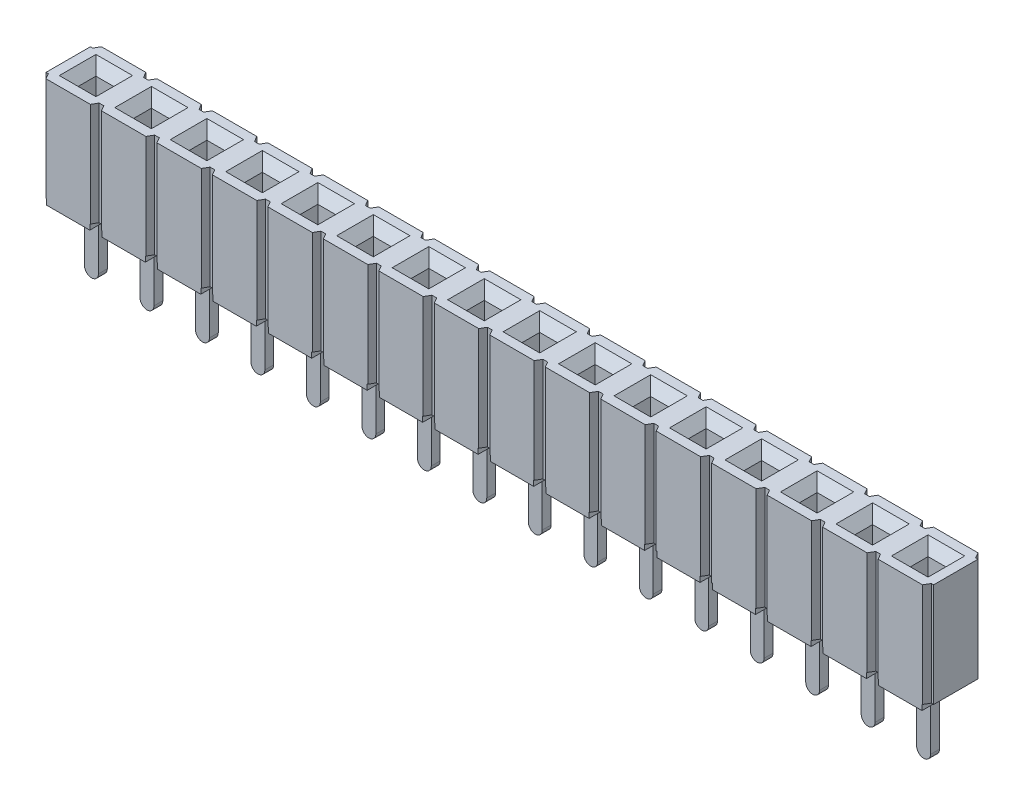
from build123d import *

# Parameters (mm, degrees)
SKETCH1_W                      = 40.64
SKETCH1_H                      = 2.54
BASE_EXTRUDE_DEPTH             = 5
SKETCH2_W                      = 1.524
SKETCH2_H                      = 0.254
STANDOFF_WIDTH_DEPTH           = 41.966114046
UPPER_START                    = -19.4945
UPPER_CORE_OUTLINE_W           = 3.3528
UPPER_CORE_OUTLINE_H           = 0.889
UPPER_CORE_DEPTH               = 0.889
LEAD_IN_SIZE                   = 0.3937
LEAD_IN_SIZE2                  = 0.469193389
CORE_PATTERN_COUNT             = 16
CORE_PATTERN_PITCH             = 2.54
LEAD_IN_OF_CORE_PATTERN_SIZE2  = 0.469193389
LEAD_IN_OF_CORE_PATTERN_SIZE   = 0.3937
POSITION_CUT_DEPTH             = 21.964620197
SKETCH10_W                     = 0.2794
SKETCH10_H                     = 0.254
STANDOFF_LENGTH_DEPTH          = 22.07970588
STANDOFF_PATTERN_COUNT         = 16
STANDOFF_PATTERN_PITCH         = 2.54
SKETCH11_W                     = 0.635
SKETCH11_H                     = 0.4064
TAIL_DEPTH                     = 3.175
TAIL_FILLETS_R                 = 0.3175
TAIL_PATTERN_COUNT             = 16
TAIL_PATTERN_PITCH             = 2.54
TAIL_FILLETS_OF_TAIL_PATTERN_R = 0.3175


# Read off the part's stored shape, not the designer's step: Upper Core
with BuildPart() as part:
    # Sketch1 → Base-Extrude (new body)
    with BuildSketch(Plane(origin=(0, 0, 0), x_dir=(1, 0, 0), z_dir=(0, 1, 0))):
        Rectangle(SKETCH1_W, SKETCH1_H)
    extrude(amount=BASE_EXTRUDE_DEPTH)

    # Sketch2 → Standoff - Width (cut, through all)
    with BuildSketch(Plane.ZY.offset(20.32)):
        with Locations((0, 0.127)):
            Rectangle(SKETCH2_W, SKETCH2_H)
    extrude(amount=-STANDOFF_WIDTH_DEPTH, mode=Mode.SUBTRACT)

    # Upper Core outline → Upper Core (cut)
    with BuildSketch(Plane.YZ.offset(UPPER_START)):
        with Locations((3.3236, 0)):
            Rectangle(UPPER_CORE_OUTLINE_W, UPPER_CORE_OUTLINE_H)
    upper_core = extrude(amount=UPPER_CORE_DEPTH, mode=Mode.SUBTRACT)

    # Lead-in
    lead_in_edges = [part.edges().sort_by_distance(p)[0] for p in [
        (-19.4945, 5, 0),
        (-19.05, 5, 0.4445),
        (-18.6055, 5, 0),
        (-19.05, 5, -0.4445),
    ]]
    lead_in_side = [part.faces().sort_by_distance(p)[0] for p in [
        (0.146976854, 5, 0),
    ]]
    chamfer(lead_in_edges, length=LEAD_IN_SIZE, length2=LEAD_IN_SIZE2, reference=lead_in_side[0])

    # Core Pattern: Upper Core ×16
    with Locations(*[(i * CORE_PATTERN_PITCH, 0, 0) for i in range(1, CORE_PATTERN_COUNT)]):
        add(upper_core, mode=Mode.SUBTRACT)

    # Lead-in of Core Pattern
    lead_in_of_core_pattern_edges = [part.edges().sort_by_distance(p)[0] for p in [
        (-16.9545, 5, 0),
        (-16.51, 5, 0.4445),
        (-16.0655, 5, 0),
        (-16.51, 5, -0.4445),
        (-14.4145, 5, 0),
        (-13.97, 5, 0.4445),
        (-13.5255, 5, 0),
        (-13.97, 5, -0.4445),
        (-11.8745, 5, 0),
        (-11.43, 5, 0.4445),
        (-10.9855, 5, 0),
        (-11.43, 5, -0.4445),
        (-9.3345, 5, 0),
        (-8.89, 5, 0.4445),
        (-8.4455, 5, 0),
        (-8.89, 5, -0.4445),
        (-6.7945, 5, 0),
        (-6.35, 5, 0.4445),
        (-5.9055, 5, 0),
        (-6.35, 5, -0.4445),
        (-4.2545, 5, 0),
        (-3.81, 5, 0.4445),
        (-3.3655, 5, 0),
        (-3.81, 5, -0.4445),
        (-1.7145, 5, 0),
        (-1.27, 5, 0.4445),
        (-0.8255, 5, 0),
        (-1.27, 5, -0.4445),
        (0.8255, 5, 0),
        (1.27, 5, 0.4445),
        (1.7145, 5, 0),
        (1.27, 5, -0.4445),
        (3.3655, 5, 0),
        (3.81, 5, 0.4445),
        (4.2545, 5, 0),
        (3.81, 5, -0.4445),
        (5.9055, 5, 0),
        (6.35, 5, 0.4445),
        (6.7945, 5, 0),
        (6.35, 5, -0.4445),
        (8.4455, 5, 0),
        (8.89, 5, 0.4445),
        (9.3345, 5, 0),
        (8.89, 5, -0.4445),
        (10.9855, 5, 0),
        (11.43, 5, 0.4445),
        (11.8745, 5, 0),
        (11.43, 5, -0.4445),
        (13.5255, 5, 0),
        (13.97, 5, 0.4445),
        (14.4145, 5, 0),
        (13.97, 5, -0.4445),
        (16.0655, 5, 0),
        (16.51, 5, 0.4445),
        (16.9545, 5, 0),
        (16.51, 5, -0.4445),
        (18.6055, 5, 0),
        (19.05, 5, 0.4445),
        (19.4945, 5, 0),
        (19.05, 5, -0.4445),
    ]]
    chamfer(lead_in_of_core_pattern_edges, length=LEAD_IN_OF_CORE_PATTERN_SIZE, length2=LEAD_IN_OF_CORE_PATTERN_SIZE2)

    # Sketch4 → Position Cut (cut, through all)
    with BuildSketch(Plane(origin=(0, 5, 0), x_dir=(-1, 0, 0), z_dir=(0, 1, 0))):
        Polygon((20.32, 1.016), (20.212646968, 1.016), (20.066, 1.27), (20.32, 1.27), align=None)
        Polygon((20.066, -1.27), (20.32, -1.27), (20.32, -1.016), (20.212646968, -1.016), align=None)
        Polygon((17.78, -1.016), (17.887353032, -1.016), (18.034, -1.27), (17.78, -1.27), align=None)
        Polygon((18.034, 1.27), (17.78, 1.27), (17.78, 1.016), (17.887353032, 1.016), align=None)
    position_cut = extrude(amount=-POSITION_CUT_DEPTH, mode=Mode.SUBTRACT)

    # Sketch10 → Standoff - Length (cut, through all)
    with BuildSketch(Plane.XY.offset(1.27)):
        with Locations((-17.9197, 0.127)):
            Rectangle(SKETCH10_W, SKETCH10_H)
        with Locations((-20.1803, 0.127)):
            Rectangle(SKETCH10_W, SKETCH10_H)
    standoff_length = extrude(amount=-STANDOFF_LENGTH_DEPTH, mode=Mode.SUBTRACT)

    # Standoff Pattern: Position Cut, Standoff - Length ×16
    with Locations(*[(i * STANDOFF_PATTERN_PITCH, 0, 0) for i in range(1, STANDOFF_PATTERN_COUNT)]):
        add(position_cut, mode=Mode.SUBTRACT)
        add(standoff_length, mode=Mode.SUBTRACT)

    # Sketch11 → Tail (add)
    with BuildSketch(Plane.XZ.offset(-0.254)):
        with Locations((-19.05, 0)):
            Rectangle(SKETCH11_W, SKETCH11_H)
    tail = extrude(amount=TAIL_DEPTH)

    # Tail Fillets
    tail_fillets_edges = [part.edges().sort_by_distance(p)[0] for p in [
        (-19.3675, -2.921, 0),
        (-18.7325, -2.921, 0),
    ]]
    fillet(tail_fillets_edges, radius=TAIL_FILLETS_R - 0.0001)  # a hair under: the kernel refuses the full size

    # Tail Pattern: Tail ×16
    with Locations(*[(i * TAIL_PATTERN_PITCH, 0, 0) for i in range(1, TAIL_PATTERN_COUNT)]):
        add(tail)

    # Tail Fillets of Tail Pattern
    tail_fillets_of_tail_pattern_edges = [part.edges().sort_by_distance(p)[0] for p in [
        (-16.8275, -2.921, 0),
        (-16.1925, -2.921, 0),
        (-14.2875, -2.921, 0),
        (-13.6525, -2.921, 0),
        (-11.7475, -2.921, 0),
        (-11.1125, -2.921, 0),
        (-9.2075, -2.921, 0),
        (-8.5725, -2.921, 0),
        (-6.6675, -2.921, 0),
        (-6.0325, -2.921, 0),
        (-4.1275, -2.921, 0),
        (-3.4925, -2.921, 0),
        (-1.5875, -2.921, 0),
        (-0.9525, -2.921, 0),
        (0.9525, -2.921, 0),
        (1.5875, -2.921, 0),
        (3.4925, -2.921, 0),
        (4.1275, -2.921, 0),
        (6.0325, -2.921, 0),
        (6.6675, -2.921, 0),
        (8.5725, -2.921, 0),
        (9.2075, -2.921, 0),
        (11.1125, -2.921, 0),
        (11.7475, -2.921, 0),
        (13.6525, -2.921, 0),
        (14.2875, -2.921, 0),
        (16.1925, -2.921, 0),
        (16.8275, -2.921, 0),
        (18.7325, -2.921, 0),
        (19.3675, -2.921, 0),
    ]]
    fillet(tail_fillets_of_tail_pattern_edges, radius=TAIL_FILLETS_OF_TAIL_PATTERN_R - 0.0001)  # a hair under: the kernel refuses the full size


solid = part.part
